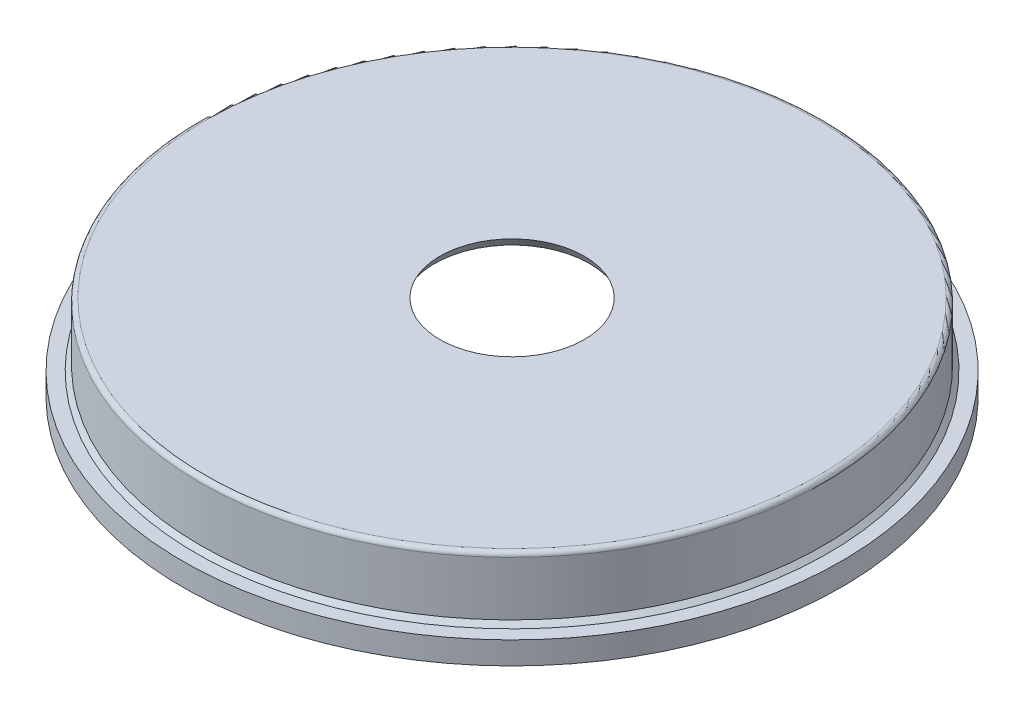
from build123d import *


with BuildPart() as part:
    # Schizzo1 → Rivoluzione1 (revolve)
    with BuildSketch(Plane(origin=(0, 0, 0), x_dir=(0, 0, -1), z_dir=(1, 0, 0))):
        with BuildLine():
            Line((-73, 0), (-72, 0))
            Line((-72, 0), (-72, 3))
            Line((-72, 3), (-67, 3))
            Line((-67, 3), (-67, 17))
            Line((-67, 17), (-17.154700538, 17))
            Line((-17.154700538, 17), (-16, 19))
            Line((-16, 19), (-68, 19))
            ThreePointArc((-68, 19), (-68.707106781, 18.707106781), (-69, 18))
            Line((-69, 18), (-69, 6))
            Line((-69, 6), (-70, 5))
            Line((-70, 5), (-73, 5))
            Line((-73, 5), (-73, 0))
        make_face()
    revolve(axis=Axis((0, 0, 0), (0, 1, 0)))


solid = part.part
